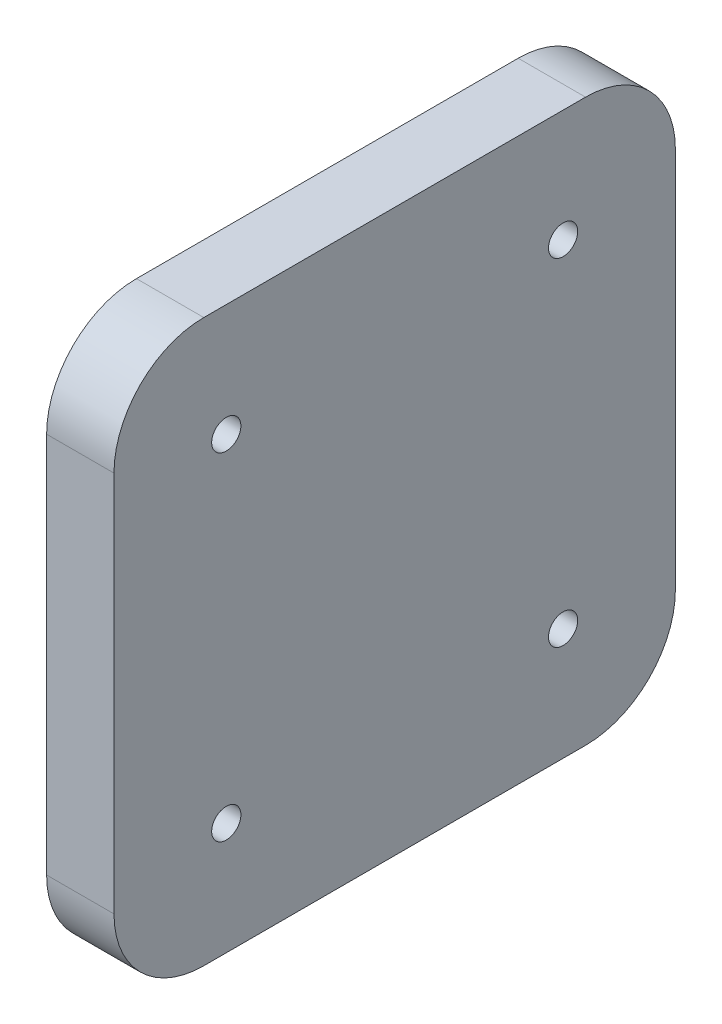
from build123d import *

# Parameters (mm, degrees)
SKETCH1_W           = 50
SKETCH1_H           = 50
SKETCH1_R           = 1.3
BOSS_EXTRUDE1_DEPTH = 6
FILLET1_R           = 8
SKETCH2_W           = 4
SKETCH2_H           = 8
BOSS_EXTRUDE2_DEPTH = 6
FILLET2_R           = 4
SKETCH6_R           = 1.6
CUT_EXTRUDE3_DEPTH  = 36
SKETCH4_W           = 5
SKETCH4_H           = 8
BOSS_EXTRUDE4_DEPTH = 5
FILLET3_R           = 3.5
SKETCH5_R           = 0.7
CUT_EXTRUDE2_DEPTH  = 44
CHAMFER3_SIZE       = 1.2


with BuildPart() as part:
    # Sketch1 → Boss-Extrude1 (new body)
    with BuildSketch(Plane(origin=(0, 0, 0), x_dir=(0, 0, -1), z_dir=(1, 0, 0))):
        Rectangle(SKETCH1_W, SKETCH1_H)
        with Locations((-15, 15)):
            Circle(SKETCH1_R, mode=Mode.SUBTRACT)
        with Locations((15, 15)):
            Circle(SKETCH1_R, mode=Mode.SUBTRACT)
        with Locations((15, -15)):
            Circle(SKETCH1_R, mode=Mode.SUBTRACT)
        with Locations((-15, -15)):
            Circle(SKETCH1_R, mode=Mode.SUBTRACT)
    extrude(amount=BOSS_EXTRUDE1_DEPTH)

    # Fillet1
    fillet1_edges = [part.edges().sort_by_distance(p)[0] for p in [
        (3, -25, -25),
        (3, -25, 25),
        (3, 25, 25),
        (3, 25, -25),
    ]]
    fillet(fillet1_edges, radius=FILLET1_R)

    # Sketch2 → Boss-Extrude2 (add)
    with BuildSketch(Plane.ZY):
        with Locations((-5.05, -21)):
            Rectangle(SKETCH2_W, SKETCH2_H)
        with Locations((5.05, -21)):
            Rectangle(SKETCH2_W, SKETCH2_H)
    extrude(amount=BOSS_EXTRUDE2_DEPTH)

    # Fillet2
    fillet2_edges = [part.edges().sort_by_distance(p)[0] for p in [
        (-6, -25, 5.05),
        (-6, -25, -5.05),
        (-6, -17, -5.05),
        (-6, -17, 5.05),
    ]]
    fillet(fillet2_edges, radius=FILLET2_R - 0.0001)  # a hair under: the kernel refuses the full size

    # Sketch6 → Cut-Extrude3 (cut)
    with BuildSketch(Plane(origin=(0, 0, -7.05), x_dir=(-1, 0, 0), z_dir=(0, 0, -1))):
        with Locations((3, -21)):
            Circle(SKETCH6_R)
    extrude(amount=-CUT_EXTRUDE3_DEPTH, mode=Mode.SUBTRACT)

    # Sketch4 → Boss-Extrude4 (add)
    with BuildSketch(Plane.ZY):
        with Locations((-17.5, -9)):
            Rectangle(SKETCH4_W, SKETCH4_H)
        with Locations((17.5, -9)):
            Rectangle(SKETCH4_W, SKETCH4_H)
    extrude(amount=BOSS_EXTRUDE4_DEPTH)

    # Fillet3
    fillet3_edges = [part.edges().sort_by_distance(p)[0] for p in [
        (-5, -5, -17.5),
        (-5, -13, -17.5),
        (-5, -13, 17.5),
        (-5, -5, 17.5),
    ]]
    fillet(fillet3_edges, radius=FILLET3_R)

    # Sketch5 → Cut-Extrude2 (cut)
    with BuildSketch(Plane(origin=(0, 0, -20), x_dir=(-1, 0, 0), z_dir=(0, 0, -1))):
        with Locations(Location((2.5, -9, 0), (0, 0, 90))):
            Circle(SKETCH5_R)
    extrude(amount=-CUT_EXTRUDE2_DEPTH, mode=Mode.SUBTRACT)

    # Chamfer3
    chamfer3_edges = [part.edges().sort_by_distance(p)[0] for p in [
        (-5, -9, 15),
        (-0.75, -13, 15),
        (-0.75, -5, 15),
        (-3.974873734, -6.025126266, 15),
        (-3.974873734, -11.974873734, 15),
        (-5, -9, -15),
        (-0.75, -5, -15),
        (-0.75, -13, -15),
        (-3.974873734, -6.025126266, -15),
        (-3.974873734, -11.974873734, -15),
    ]]
    chamfer(chamfer3_edges, length=CHAMFER3_SIZE)


solid = part.part
